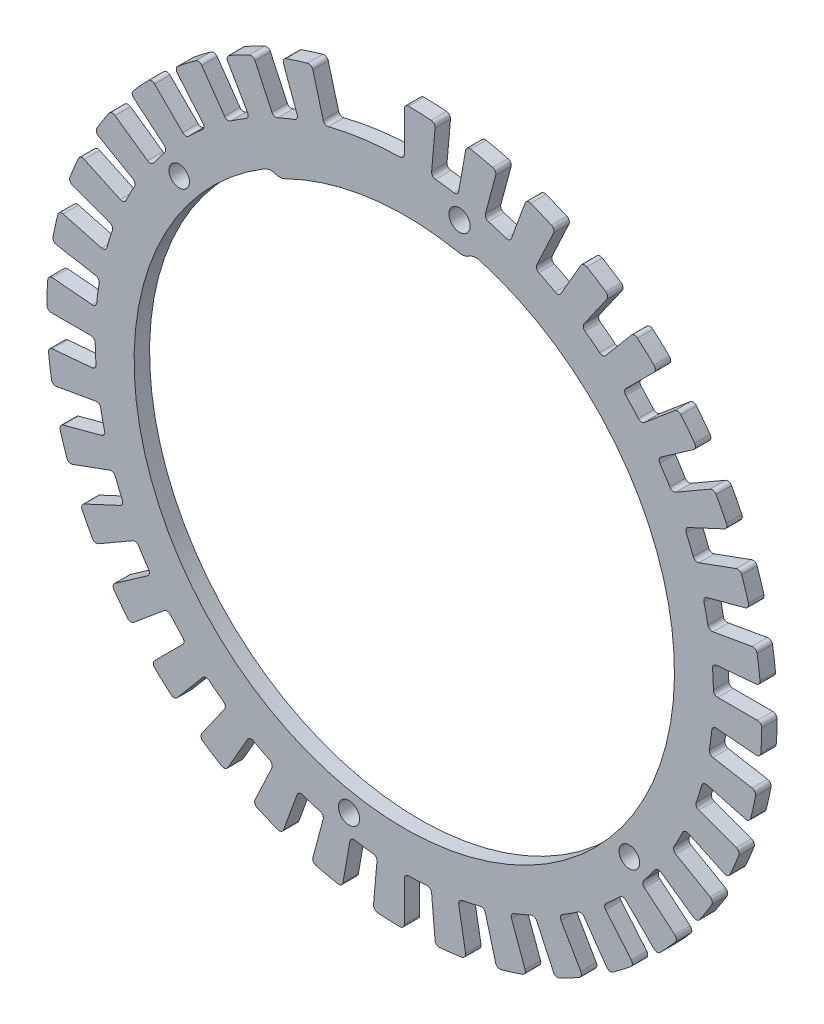
from build123d import *

# Parameters (mm, degrees)
SKETCH1_R           = 2.4585
SKETCH1_R_2         = 2.38125
BOSS_EXTRUDE1_DEPTH = 3.571875


with BuildPart() as part:
    # Sketch1 → Boss-Extrude1 (new body)
    with BuildSketch(Plane.XY):
        with BuildLine():
            Line((7.120090774, 81.383009943), (6.318190247, 72.217244977))
            ThreePointArc((6.318190247, 72.217244977), (6.543925597, 71.492600102), (7.213496876, 71.135191451))
            ThreePointArc((7.213496876, 71.135191451), (9.332622744, 70.888307588), (11.443439394, 70.578308954))
            ThreePointArc((11.443439394, 70.578308954), (12.182699751, 70.750241401), (12.58829525, 71.391769993))
            Line((12.58829525, 71.391769993), (14.185993357, 80.45276622))
            ThreePointArc((14.185993357, 80.45276622), (14.60224868, 81.101765071), (15.35649023, 81.261726586))
            ThreePointArc((15.35649023, 81.261726586), (17.899556073, 80.739679789), (20.424982959, 80.138068801))
            ThreePointArc((20.424982959, 80.138068801), (21.040955292, 79.674338181), (21.143931966, 78.910228368))
            Line((21.143931966, 78.910228368), (18.762595726, 70.022960532))
            ThreePointArc((18.762595726, 70.022960532), (18.859068387, 69.270126109), (19.456404014, 68.801877466))
            ThreePointArc((19.456404014, 68.801877466), (21.500464665, 68.190761978), (23.525382569, 67.518933456))
            ThreePointArc((23.525382569, 67.518933456), (24.283267656, 67.559882649), (24.794101519, 68.12123406))
            Line((24.794101519, 68.12123406), (27.940952485, 76.76713603))
            ThreePointArc((27.940952485, 76.76713603), (28.463581422, 77.333993152), (29.234141374, 77.360551822))
            ThreePointArc((29.234141374, 77.360551822), (31.647919857, 76.404837339), (34.030511182, 75.373830397))
            ThreePointArc((34.030511182, 75.373830397), (34.556599534, 74.810182414), (34.525325484, 74.039799434))
            Line((34.525325484, 74.039799434), (30.636909229, 65.701063864))
            ThreePointArc((30.636909229, 65.701063864), (30.601187928, 64.942914386), (31.108138161, 64.378053249))
            ThreePointArc((31.108138161, 64.378053249), (33.015025846, 63.421274572), (34.892518899, 62.40802933))
            ThreePointArc((34.892518899, 62.40802933), (35.646000762, 62.316751049), (36.24655156, 62.780868901))
            Line((36.24655156, 62.780868901), (40.84693991, 70.748975258))
            ThreePointArc((40.84693991, 70.748975258), (41.460062645, 71.216466984), (42.223527925, 71.108815836))
            ThreePointArc((42.223527925, 71.108815836), (44.43467761, 69.748472569), (46.602039543, 68.319396297))
            ThreePointArc((46.602039543, 68.319396297), (47.022258986, 67.67295711), (46.857684459, 66.91970866))
            Line((46.857684459, 66.91970866), (41.580335748, 59.382873618))
            ThreePointArc((41.580335748, 59.382873618), (41.413505858, 58.642445073), (41.814667271, 57.998134462))
            ThreePointArc((41.814667271, 57.998134462), (43.526442174, 56.724763831), (45.199463699, 55.400888814))
            ThreePointArc((45.199463699, 55.400888814), (45.925648172, 55.180156502), (46.597668473, 55.53293881))
            Line((46.597668473, 55.53293881), (52.511813735, 62.581142673))
            ThreePointArc((52.511813735, 62.581142673), (53.196800845, 62.935064503), (53.929973946, 62.696474464))
            ThreePointArc((53.929973946, 62.696474464), (55.87131017, 60.972835754), (57.757588515, 59.189111912))
            ThreePointArc((57.757588515, 59.189111912), (58.059170893, 58.479523249), (57.766296402, 57.766296402))
            Line((57.766296402, 57.766296402), (51.260364806, 51.260364806))
            ThreePointArc((51.260364806, 51.260364806), (50.967495369, 50.56015474), (51.250678875, 49.855971707))
            ThreePointArc((51.250678875, 49.855971707), (52.715329582, 48.304699845), (54.133045666, 46.710420325))
            ThreePointArc((54.133045666, 46.710420325), (54.809868002, 46.366940822), (55.53293881, 46.597668473))
            Line((55.53293881, 46.597668473), (62.581142673, 52.511813735))
            ThreePointArc((62.581142673, 52.511813735), (63.31718117, 52.741411935), (63.997784998, 52.379132441))
            ThreePointArc((63.997784998, 52.379132441), (65.610321242, 50.344570179), (67.158202386, 48.260396313))
            ThreePointArc((67.158202386, 48.260396313), (67.331984272, 47.509218665), (66.91970866, 46.857684459))
            Line((66.91970866, 46.857684459), (59.382873618, 41.580335748))
            ThreePointArc((59.382873618, 41.580335748), (58.972863325, 40.94161969), (59.129464536, 40.19896048))
            ThreePointArc((59.129464536, 40.19896048), (60.302488376, 38.416921997), (61.421822434, 36.600679351))
            ThreePointArc((61.421822434, 36.600679351), (62.028717727, 36.144889108), (62.780868901, 36.24655156))
            Line((62.780868901, 36.24655156), (70.748975258, 40.84693991))
            ThreePointArc((70.748975258, 40.84693991), (71.513700985, 40.945238253), (72.121055738, 40.470276985))
            ThreePointArc((72.121055738, 40.470276985), (73.355795904, 38.186610315), (74.518248261, 35.865312993))
            ThreePointArc((74.518248261, 35.865312993), (74.55894938, 35.095370514), (74.039799434, 34.525325484))
            Line((74.039799434, 34.525325484), (65.701063864, 30.636909229))
            ThreePointArc((65.701063864, 30.636909229), (65.186370669, 30.079094244), (65.211631338, 29.320524181))
            ThreePointArc((65.211631338, 29.320524181), (66.057386575, 27.361865414), (66.844328207, 25.378845255))
            ThreePointArc((66.844328207, 25.378845255), (67.362856253, 24.824593229), (68.12123406, 24.794101519))
            Line((68.12123406, 24.794101519), (76.76713603, 27.940952485))
            ThreePointArc((76.76713603, 27.940952485), (77.537313183, 27.904964226), (78.052964694, 27.331752641))
            ThreePointArc((78.052964694, 27.331752641), (78.872391827, 24.868369619), (79.614094871, 22.380480286))
            ThreePointArc((79.614094871, 22.380480286), (79.52047854, 21.615167288), (78.910228368, 21.143931966))
            Line((78.910228368, 21.143931966), (70.022960532, 18.762595726))
            ThreePointArc((70.022960532, 18.762595726), (69.419223127, 18.30263074), (69.312375721, 17.551198591))
            ThreePointArc((69.312375721, 17.551198591), (69.805164509, 15.475432397), (70.235802893, 13.385887789))
            ThreePointArc((70.235802893, 13.385887789), (70.650208479, 12.750014647), (71.391769993, 12.58829525))
            Line((71.391769993, 12.58829525), (80.45276622, 14.185993357))
            ThreePointArc((80.45276622, 14.185993357), (81.204993357, 14.016811982), (81.613273815, 13.362766823))
            ThreePointArc((81.613273815, 13.362766823), (81.992490036, 10.794516097), (82.290907495, 8.215628011))
            ThreePointArc((82.290907495, 8.215628011), (82.065818199, 7.478198142), (81.383009943, 7.120090774))
            Line((81.383009943, 7.120090774), (72.217244977, 6.318190247))
            ThreePointArc((72.217244977, 6.318190247), (71.542807618, 5.970051062), (71.30709864, 5.248588713))
            ThreePointArc((71.30709864, 5.248588713), (71.431947843, 3.118786197), (71.49319825, 0.986206897))
            ThreePointArc((71.49319825, 0.986206897), (71.79088987, 0.288033321), (72.49310312, 0))
            Line((72.49310312, 0), (81.69387982, 0))
            ThreePointArc((81.69387982, 0), (82.405300898, -0.297234001), (82.693804909, -1.012239902))
            ThreePointArc((82.693804909, -1.012239902), (82.621287925, -3.607323335), (82.467352536, -6.198851964))
            ThreePointArc((82.467352536, -6.198851964), (82.1176295, -6.88599227), (81.383009943, -7.120090774))
            Line((81.383009943, -7.120090774), (72.217244977, -6.318190247))
            ThreePointArc((72.217244977, -6.318190247), (71.492600102, -6.543925597), (71.135191451, -7.213496876))
            ThreePointArc((71.135191451, -7.213496876), (70.888307588, -9.332622744), (70.578308954, -11.443439394))
            ThreePointArc((70.578308954, -11.443439394), (70.750241401, -12.182699751), (71.391769993, -12.58829525))
            Line((71.391769993, -12.58829525), (80.45276622, -14.185993357))
            ThreePointArc((80.45276622, -14.185993357), (81.101765071, -14.60224868), (81.261726586, -15.35649023))
            ThreePointArc((81.261726586, -15.35649023), (80.739679789, -17.899556073), (80.138068801, -20.424982959))
            ThreePointArc((80.138068801, -20.424982959), (79.674338181, -21.040955292), (78.910228368, -21.143931966))
            Line((78.910228368, -21.143931966), (70.022960532, -18.762595726))
            ThreePointArc((70.022960532, -18.762595726), (69.270126109, -18.859068387), (68.801877466, -19.456404014))
            ThreePointArc((68.801877466, -19.456404014), (68.190761979, -21.500464665), (67.518933456, -23.525382569))
            ThreePointArc((67.518933456, -23.525382569), (67.559882649, -24.283267656), (68.12123406, -24.794101519))
            Line((68.12123406, -24.794101519), (76.76713603, -27.940952485))
            ThreePointArc((76.76713603, -27.940952485), (77.333993152, -28.463581422), (77.360551822, -29.234141374))
            ThreePointArc((77.360551822, -29.234141374), (76.404837339, -31.647919857), (75.373830397, -34.030511182))
            ThreePointArc((75.373830397, -34.030511182), (74.810182414, -34.556599534), (74.039799434, -34.525325484))
            Line((74.039799434, -34.525325484), (65.701063864, -30.636909229))
            ThreePointArc((65.701063864, -30.636909229), (64.942914386, -30.601187928), (64.378053249, -31.10813816))
            ThreePointArc((64.378053249, -31.10813816), (63.421274572, -33.015025846), (62.40802933, -34.892518899))
            ThreePointArc((62.40802933, -34.892518899), (62.316751049, -35.646000762), (62.780868901, -36.24655156))
            Line((62.780868901, -36.24655156), (70.748975258, -40.84693991))
            ThreePointArc((70.748975258, -40.84693991), (71.216466984, -41.460062645), (71.108815836, -42.223527925))
            ThreePointArc((71.108815836, -42.223527925), (69.748472569, -44.43467761), (68.319396297, -46.602039543))
            ThreePointArc((68.319396297, -46.602039543), (67.67295711, -47.022258986), (66.91970866, -46.857684459))
            Line((66.91970866, -46.857684459), (59.382873618, -41.580335748))
            ThreePointArc((59.382873618, -41.580335748), (58.642445073, -41.413505858), (57.998134462, -41.814667271))
            ThreePointArc((57.998134462, -41.814667271), (56.724763831, -43.526442174), (55.400888814, -45.199463699))
            ThreePointArc((55.400888814, -45.199463699), (55.180156502, -45.925648172), (55.53293881, -46.597668473))
            Line((55.53293881, -46.597668473), (62.581142673, -52.511813735))
            ThreePointArc((62.581142673, -52.511813735), (62.935064503, -53.196800845), (62.696474464, -53.929973946))
            ThreePointArc((62.696474464, -53.929973946), (60.972835754, -55.87131017), (59.189111912, -57.757588515))
            ThreePointArc((59.189111912, -57.757588515), (58.479523249, -58.059170893), (57.766296402, -57.766296402))
            Line((57.766296402, -57.766296402), (51.260364806, -51.260364806))
            ThreePointArc((51.260364806, -51.260364806), (50.56015474, -50.967495369), (49.855971707, -51.250678875))
            ThreePointArc((49.855971707, -51.250678875), (48.304699845, -52.715329582), (46.710420325, -54.133045666))
            ThreePointArc((46.710420325, -54.133045666), (46.366940822, -54.809868002), (46.597668473, -55.53293881))
            Line((46.597668473, -55.53293881), (52.511813735, -62.581142673))
            ThreePointArc((52.511813735, -62.581142673), (52.741411935, -63.31718117), (52.379132441, -63.997784998))
            ThreePointArc((52.379132441, -63.997784998), (50.344570179, -65.610321242), (48.260396313, -67.158202386))
            ThreePointArc((48.260396313, -67.158202386), (47.509218665, -67.331984272), (46.857684459, -66.91970866))
            Line((46.857684459, -66.91970866), (41.580335748, -59.382873618))
            ThreePointArc((41.580335748, -59.382873618), (40.94161969, -58.972863325), (40.19896048, -59.129464536))
            ThreePointArc((40.19896048, -59.129464536), (38.416921997, -60.302488376), (36.600679351, -61.421822434))
            ThreePointArc((36.600679351, -61.421822434), (36.144889108, -62.028717727), (36.24655156, -62.780868901))
            Line((36.24655156, -62.780868901), (40.84693991, -70.748975258))
            ThreePointArc((40.84693991, -70.748975258), (40.945238253, -71.513700985), (40.470276985, -72.121055738))
            ThreePointArc((40.470276985, -72.121055738), (38.186610315, -73.355795904), (35.865312993, -74.518248261))
            ThreePointArc((35.865312993, -74.518248261), (35.095370514, -74.55894938), (34.525325484, -74.039799434))
            Line((34.525325484, -74.039799434), (30.636909229, -65.701063864))
            ThreePointArc((30.636909229, -65.701063864), (30.079094244, -65.186370669), (29.320524181, -65.211631338))
            ThreePointArc((29.320524181, -65.211631338), (27.361865414, -66.057386575), (25.378845255, -66.844328207))
            ThreePointArc((25.378845255, -66.844328207), (24.824593229, -67.362856253), (24.794101519, -68.12123406))
            Line((24.794101519, -68.12123406), (27.940952485, -76.76713603))
            ThreePointArc((27.940952485, -76.76713603), (27.904964226, -77.537313183), (27.331752641, -78.052964694))
            ThreePointArc((27.331752641, -78.052964694), (24.868369619, -78.872391827), (22.380480286, -79.614094871))
            ThreePointArc((22.380480286, -79.614094871), (21.615167288, -79.52047854), (21.143931966, -78.910228368))
            Line((21.143931966, -78.910228368), (18.762595726, -70.022960532))
            ThreePointArc((18.762595726, -70.022960532), (18.30263074, -69.419223127), (17.551198591, -69.312375721))
            ThreePointArc((17.551198591, -69.312375721), (15.475432397, -69.805164509), (13.385887789, -70.235802893))
            ThreePointArc((13.385887789, -70.235802893), (12.750014647, -70.650208479), (12.58829525, -71.391769993))
            Line((12.58829525, -71.391769993), (14.185993357, -80.45276622))
            ThreePointArc((14.185993357, -80.45276622), (14.016811982, -81.204993357), (13.362766823, -81.613273815))
            ThreePointArc((13.362766823, -81.613273815), (10.794516097, -81.992490036), (8.215628011, -82.290907495))
            ThreePointArc((8.215628011, -82.290907495), (7.478198142, -82.065818199), (7.120090774, -81.383009943))
            Line((7.120090774, -81.383009943), (6.318190247, -72.217244977))
            ThreePointArc((6.318190247, -72.217244977), (5.970051062, -71.542807618), (5.248588713, -71.30709864))
            ThreePointArc((5.248588713, -71.30709864), (3.118786197, -71.431947843), (0.986206897, -71.49319825))
            ThreePointArc((0.986206897, -71.49319825), (0.288033321, -71.79088987), (0, -72.49310312))
            Line((0, -72.49310312), (0, -81.69387982))
            ThreePointArc((0, -81.69387982), (-0.297234001, -82.405300898), (-1.012239902, -82.693804909))
            ThreePointArc((-1.012239902, -82.693804909), (-3.607323335, -82.621287925), (-6.198851964, -82.467352536))
            ThreePointArc((-6.198851964, -82.467352536), (-6.88599227, -82.1176295), (-7.120090774, -81.383009943))
            Line((-7.120090774, -81.383009943), (-6.318190247, -72.217244977))
            ThreePointArc((-6.318190247, -72.217244977), (-6.543925597, -71.492600102), (-7.213496876, -71.135191451))
            ThreePointArc((-7.213496876, -71.135191451), (-9.332622744, -70.888307588), (-11.443439394, -70.578308954))
            ThreePointArc((-11.443439394, -70.578308954), (-12.182699751, -70.750241401), (-12.58829525, -71.391769993))
            Line((-12.58829525, -71.391769993), (-14.185993357, -80.45276622))
            ThreePointArc((-14.185993357, -80.45276622), (-14.60224868, -81.101765071), (-15.35649023, -81.261726586))
            ThreePointArc((-15.35649023, -81.261726586), (-17.899556073, -80.739679789), (-20.424982959, -80.138068801))
            ThreePointArc((-20.424982959, -80.138068801), (-21.040955292, -79.674338181), (-21.143931966, -78.910228368))
            Line((-21.143931966, -78.910228368), (-18.762595726, -70.022960532))
            ThreePointArc((-18.762595726, -70.022960532), (-18.859068387, -69.270126109), (-19.456404014, -68.801877466))
            ThreePointArc((-19.456404014, -68.801877466), (-21.500464665, -68.190761979), (-23.525382569, -67.518933456))
            ThreePointArc((-23.525382569, -67.518933456), (-24.283267656, -67.559882649), (-24.794101519, -68.12123406))
            Line((-24.794101519, -68.12123406), (-27.940952485, -76.76713603))
            ThreePointArc((-27.940952485, -76.76713603), (-28.463581422, -77.333993152), (-29.234141374, -77.360551822))
            ThreePointArc((-29.234141374, -77.360551822), (-31.647919857, -76.404837339), (-34.030511182, -75.373830397))
            ThreePointArc((-34.030511182, -75.373830397), (-34.556599534, -74.810182414), (-34.525325484, -74.039799434))
            Line((-34.525325484, -74.039799434), (-30.636909229, -65.701063864))
            ThreePointArc((-30.636909229, -65.701063864), (-30.601187928, -64.942914386), (-31.10813816, -64.378053249))
            ThreePointArc((-31.10813816, -64.378053249), (-33.015025846, -63.421274572), (-34.892518899, -62.40802933))
            ThreePointArc((-34.892518899, -62.40802933), (-35.646000762, -62.316751049), (-36.24655156, -62.780868901))
            Line((-36.24655156, -62.780868901), (-40.84693991, -70.748975258))
            ThreePointArc((-40.84693991, -70.748975258), (-41.460062645, -71.216466984), (-42.223527925, -71.108815836))
            ThreePointArc((-42.223527925, -71.108815836), (-44.43467761, -69.748472569), (-46.602039543, -68.319396297))
            ThreePointArc((-46.602039543, -68.319396297), (-47.022258986, -67.67295711), (-46.857684459, -66.91970866))
            Line((-46.857684459, -66.91970866), (-41.580335748, -59.382873618))
            ThreePointArc((-41.580335748, -59.382873618), (-41.413505858, -58.642445073), (-41.814667271, -57.998134462))
            ThreePointArc((-41.814667271, -57.998134462), (-43.526442174, -56.724763831), (-45.199463699, -55.400888814))
            ThreePointArc((-45.199463699, -55.400888814), (-45.925648172, -55.180156502), (-46.597668473, -55.53293881))
            Line((-46.597668473, -55.53293881), (-52.511813735, -62.581142673))
            ThreePointArc((-52.511813735, -62.581142673), (-53.196800845, -62.935064504), (-53.929973946, -62.696474464))
            ThreePointArc((-53.929973946, -62.696474464), (-55.87131017, -60.972835754), (-57.757588515, -59.189111912))
            ThreePointArc((-57.757588515, -59.189111912), (-58.059170893, -58.479523249), (-57.766296402, -57.766296402))
            Line((-57.766296402, -57.766296402), (-51.260364806, -51.260364806))
            ThreePointArc((-51.260364806, -51.260364806), (-50.967495369, -50.56015474), (-51.250678875, -49.855971707))
            ThreePointArc((-51.250678875, -49.855971707), (-52.715329582, -48.304699845), (-54.133045666, -46.710420325))
            ThreePointArc((-54.133045666, -46.710420325), (-54.809868002, -46.366940822), (-55.53293881, -46.597668473))
            Line((-55.53293881, -46.597668473), (-62.581142673, -52.511813735))
            ThreePointArc((-62.581142673, -52.511813735), (-63.31718117, -52.741411935), (-63.997784998, -52.379132441))
            ThreePointArc((-63.997784998, -52.379132441), (-65.610321242, -50.344570179), (-67.158202386, -48.260396313))
            ThreePointArc((-67.158202386, -48.260396313), (-67.331984272, -47.509218665), (-66.91970866, -46.857684459))
            Line((-66.91970866, -46.857684459), (-59.382873618, -41.580335748))
            ThreePointArc((-59.382873618, -41.580335748), (-58.972863325, -40.94161969), (-59.129464536, -40.19896048))
            ThreePointArc((-59.129464536, -40.19896048), (-60.302488376, -38.416921997), (-61.421822434, -36.600679351))
            ThreePointArc((-61.421822434, -36.600679351), (-62.028717727, -36.144889108), (-62.780868901, -36.24655156))
            Line((-62.780868901, -36.24655156), (-70.748975258, -40.84693991))
            ThreePointArc((-70.748975258, -40.84693991), (-71.513700985, -40.945238253), (-72.121055738, -40.470276985))
            ThreePointArc((-72.121055738, -40.470276985), (-73.355795904, -38.186610315), (-74.518248261, -35.865312993))
            ThreePointArc((-74.518248261, -35.865312993), (-74.55894938, -35.095370514), (-74.039799434, -34.525325484))
            Line((-74.039799434, -34.525325484), (-65.701063864, -30.636909229))
            ThreePointArc((-65.701063864, -30.636909229), (-65.186370669, -30.079094244), (-65.211631338, -29.320524181))
            ThreePointArc((-65.211631338, -29.320524181), (-66.057386575, -27.361865414), (-66.844328207, -25.378845255))
            ThreePointArc((-66.844328207, -25.378845255), (-67.362856253, -24.824593229), (-68.12123406, -24.794101519))
            Line((-68.12123406, -24.794101519), (-76.76713603, -27.940952485))
            ThreePointArc((-76.76713603, -27.940952485), (-77.537313183, -27.904964226), (-78.052964694, -27.331752641))
            ThreePointArc((-78.052964694, -27.331752641), (-78.872391827, -24.868369619), (-79.614094871, -22.380480286))
            ThreePointArc((-79.614094871, -22.380480286), (-79.52047854, -21.615167288), (-78.910228368, -21.143931966))
            Line((-78.910228368, -21.143931966), (-70.022960532, -18.762595726))
            ThreePointArc((-70.022960532, -18.762595726), (-69.419223127, -18.30263074), (-69.312375721, -17.551198591))
            ThreePointArc((-69.312375721, -17.551198591), (-69.805164509, -15.475432397), (-70.235802893, -13.385887789))
            ThreePointArc((-70.235802893, -13.385887789), (-70.650208479, -12.750014647), (-71.391769993, -12.58829525))
            Line((-71.391769993, -12.58829525), (-80.45276622, -14.185993357))
            ThreePointArc((-80.45276622, -14.185993357), (-81.204993357, -14.016811982), (-81.613273815, -13.362766823))
            ThreePointArc((-81.613273815, -13.362766823), (-81.992490036, -10.794516097), (-82.290907495, -8.215628011))
            ThreePointArc((-82.290907495, -8.215628011), (-82.065818199, -7.478198142), (-81.383009943, -7.120090774))
            Line((-81.383009943, -7.120090774), (-72.217244977, -6.318190247))
            ThreePointArc((-72.217244977, -6.318190247), (-71.542807618, -5.970051062), (-71.30709864, -5.248588713))
            ThreePointArc((-71.30709864, -5.248588713), (-71.431947843, -3.118786197), (-71.49319825, -0.986206897))
            ThreePointArc((-71.49319825, -0.986206897), (-71.79088987, -0.288033321), (-72.49310312, 0))
            Line((-72.49310312, 0), (-81.69387982, 0))
            ThreePointArc((-81.69387982, 0), (-82.405300898, 0.297234001), (-82.693804909, 1.012239902))
            ThreePointArc((-82.693804909, 1.012239902), (-82.621287925, 3.607323335), (-82.467352536, 6.198851964))
            ThreePointArc((-82.467352536, 6.198851964), (-82.1176295, 6.88599227), (-81.383009943, 7.120090774))
            Line((-81.383009943, 7.120090774), (-72.217244977, 6.318190247))
            ThreePointArc((-72.217244977, 6.318190247), (-71.492600102, 6.543925597), (-71.135191451, 7.213496876))
            ThreePointArc((-71.135191451, 7.213496876), (-70.888307588, 9.332622744), (-70.578308954, 11.443439394))
            ThreePointArc((-70.578308954, 11.443439394), (-70.750241401, 12.182699751), (-71.391769993, 12.58829525))
            Line((-71.391769993, 12.58829525), (-80.45276622, 14.185993357))
            ThreePointArc((-80.45276622, 14.185993357), (-81.101765071, 14.60224868), (-81.261726586, 15.35649023))
            ThreePointArc((-81.261726586, 15.35649023), (-80.739679789, 17.899556073), (-80.138068801, 20.424982959))
            ThreePointArc((-80.138068801, 20.424982959), (-79.674338181, 21.040955292), (-78.910228368, 21.143931966))
            Line((-78.910228368, 21.143931966), (-70.022960532, 18.762595726))
            ThreePointArc((-70.022960532, 18.762595726), (-69.270126109, 18.859068387), (-68.801877466, 19.456404014))
            ThreePointArc((-68.801877466, 19.456404014), (-68.190761979, 21.500464665), (-67.518933456, 23.525382569))
            ThreePointArc((-67.518933456, 23.525382569), (-67.559882649, 24.283267656), (-68.12123406, 24.794101519))
            Line((-68.12123406, 24.794101519), (-76.76713603, 27.940952485))
            ThreePointArc((-76.76713603, 27.940952485), (-77.333993152, 28.463581422), (-77.360551822, 29.234141374))
            ThreePointArc((-77.360551822, 29.234141374), (-76.404837339, 31.647919857), (-75.373830397, 34.030511182))
            ThreePointArc((-75.373830397, 34.030511182), (-74.810182414, 34.556599534), (-74.039799434, 34.525325484))
            Line((-74.039799434, 34.525325484), (-65.701063864, 30.636909229))
            ThreePointArc((-65.701063864, 30.636909229), (-64.942914386, 30.601187928), (-64.378053249, 31.10813816))
            ThreePointArc((-64.378053249, 31.10813816), (-63.421274572, 33.015025846), (-62.40802933, 34.892518899))
            ThreePointArc((-62.40802933, 34.892518899), (-62.316751049, 35.646000762), (-62.780868901, 36.24655156))
            Line((-62.780868901, 36.24655156), (-70.748975258, 40.84693991))
            ThreePointArc((-70.748975258, 40.84693991), (-71.216466984, 41.460062645), (-71.108815836, 42.223527925))
            ThreePointArc((-71.108815836, 42.223527925), (-69.748472569, 44.43467761), (-68.319396297, 46.602039543))
            ThreePointArc((-68.319396297, 46.602039543), (-67.67295711, 47.022258986), (-66.91970866, 46.857684459))
            Line((-66.91970866, 46.857684459), (-59.382873618, 41.580335748))
            ThreePointArc((-59.382873618, 41.580335748), (-58.642445073, 41.413505858), (-57.998134462, 41.814667271))
            ThreePointArc((-57.998134462, 41.814667271), (-56.724763831, 43.526442174), (-55.400888814, 45.199463699))
            ThreePointArc((-55.400888814, 45.199463699), (-55.180156502, 45.925648172), (-55.53293881, 46.597668473))
            Line((-55.53293881, 46.597668473), (-62.581142673, 52.511813735))
            ThreePointArc((-62.581142673, 52.511813735), (-62.935064504, 53.196800845), (-62.696474464, 53.929973946))
            ThreePointArc((-62.696474464, 53.929973946), (-60.972835754, 55.87131017), (-59.189111912, 57.757588515))
            ThreePointArc((-59.189111912, 57.757588515), (-58.479523249, 58.059170893), (-57.766296402, 57.766296402))
            Line((-57.766296402, 57.766296402), (-51.260364806, 51.260364806))
            ThreePointArc((-51.260364806, 51.260364806), (-50.56015474, 50.967495369), (-49.855971707, 51.250678875))
            ThreePointArc((-49.855971707, 51.250678875), (-48.304699845, 52.715329582), (-46.710420325, 54.133045666))
            ThreePointArc((-46.710420325, 54.133045666), (-46.366940822, 54.809868002), (-46.597668473, 55.53293881))
            Line((-46.597668473, 55.53293881), (-52.511813735, 62.581142673))
            ThreePointArc((-52.511813735, 62.581142673), (-52.741411935, 63.31718117), (-52.379132441, 63.997784998))
            ThreePointArc((-52.379132441, 63.997784998), (-50.344570179, 65.610321242), (-48.260396313, 67.158202386))
            ThreePointArc((-48.260396313, 67.158202386), (-47.509218665, 67.331984272), (-46.857684459, 66.91970866))
            Line((-46.857684459, 66.91970866), (-41.580335748, 59.382873618))
            ThreePointArc((-41.580335748, 59.382873618), (-40.94161969, 58.972863325), (-40.19896048, 59.129464536))
            ThreePointArc((-40.19896048, 59.129464536), (-38.416921997, 60.302488376), (-36.600679351, 61.421822434))
            ThreePointArc((-36.600679351, 61.421822434), (-36.144889108, 62.028717727), (-36.24655156, 62.780868901))
            Line((-36.24655156, 62.780868901), (-40.84693991, 70.748975258))
            ThreePointArc((-40.84693991, 70.748975258), (-40.945238253, 71.513700985), (-40.470276985, 72.121055738))
            ThreePointArc((-40.470276985, 72.121055738), (-38.186610315, 73.355795904), (-35.865312993, 74.518248261))
            ThreePointArc((-35.865312993, 74.518248261), (-35.095370514, 74.55894938), (-34.525325484, 74.039799434))
            Line((-34.525325484, 74.039799434), (-30.636909229, 65.701063864))
            ThreePointArc((-30.636909229, 65.701063864), (-30.079094244, 65.186370669), (-29.320524181, 65.211631338))
            ThreePointArc((-29.320524181, 65.211631338), (-27.361865414, 66.057386575), (-25.378845255, 66.844328207))
            ThreePointArc((-25.378845255, 66.844328207), (-24.824593229, 67.362856253), (-24.794101519, 68.12123406))
            Line((-24.794101519, 68.12123406), (-27.940952485, 76.76713603))
            ThreePointArc((-27.940952485, 76.76713603), (-27.904964226, 77.537313183), (-27.331752641, 78.052964694))
            ThreePointArc((-27.331752641, 78.052964694), (-24.868369619, 78.872391827), (-22.380480286, 79.614094871))
            ThreePointArc((-22.380480286, 79.614094871), (-21.615167288, 79.52047854), (-21.143931966, 78.910228368))
            Line((-21.143931966, 78.910228368), (-18.762595726, 70.022960532))
            ThreePointArc((-18.762595726, 70.022960532), (-18.30263074, 69.419223127), (-17.551198591, 69.312375721))
            ThreePointArc((-17.551198591, 69.312375721), (-15.475432397, 69.805164509), (-13.385887789, 70.235802893))
            ThreePointArc((-13.385887789, 70.235802893), (-7.213573177, 71.135183714), (-0.986360266, 71.493196134))
            ThreePointArc((-0.986360266, 71.493196134), (-0.288033321, 71.79088987), (0, 72.49310312))
            Line((0, 72.49310312), (0, 81.69387982))
            ThreePointArc((0, 81.69387982), (0.297234001, 82.405300898), (1.012239902, 82.693804909))
            ThreePointArc((1.012239902, 82.693804909), (3.607323335, 82.621287925), (6.198851964, 82.467352536))
            ThreePointArc((6.198851964, 82.467352536), (6.88599227, 82.1176295), (7.120090774, 81.383009943))
        make_face()
        with Locations((12.78420269, 65.769021291)):
            Circle(SKETCH1_R, mode=Mode.SUBTRACT)
        with Locations((-12.78420269, -65.769021291)):
            Circle(SKETCH1_R, mode=Mode.SUBTRACT)
        with Locations((52.068779418, -42.1644662)):
            Circle(SKETCH1_R_2, mode=Mode.SUBTRACT)
        with Locations((-52.068779418, 42.1644662)):
            Circle(SKETCH1_R_2, mode=Mode.SUBTRACT)
        with BuildLine():
            ThreePointArc((-32.399534916, 53.446423053), (8.157887014, -61.965303836), (17.462595357, 60.010897039))
            ThreePointArc((17.462595357, 60.010897039), (16.158723626, 60.09401264), (14.943172899, 59.61502817))
            ThreePointArc((14.943172899, 59.61502817), (13.835125402, 59.154945408), (12.635405963, 59.165839098))
            ThreePointArc((12.635405963, 59.165839098), (-7.879614623, 59.851615177), (-27.518110923, 53.879528313))
            ThreePointArc((-27.518110923, 53.879528313), (-28.674131419, 53.558495577), (-29.863501295, 53.716117604))
            ThreePointArc((-29.863501295, 53.716117604), (-31.161603438, 53.864173396), (-32.399534916, 53.446423053))
        make_face(mode=Mode.SUBTRACT)
    extrude(amount=BOSS_EXTRUDE1_DEPTH)


solid = part.part
